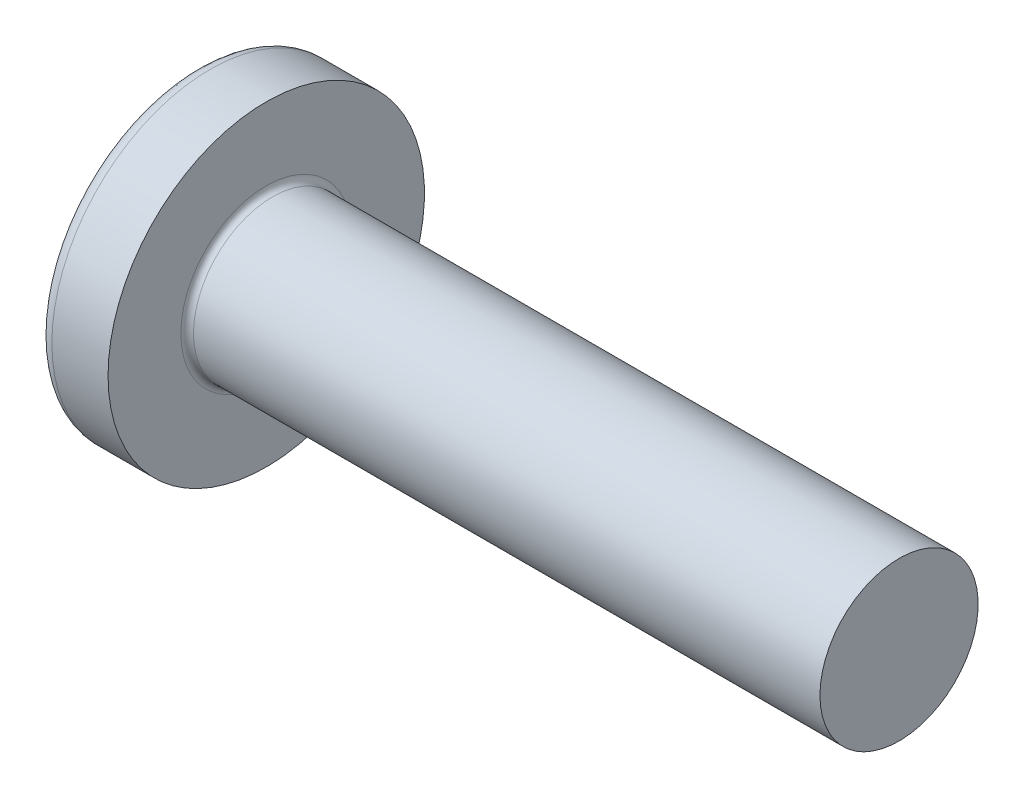
from build123d import *

# Parameters (mm, degrees)
RECPAT_COUNT = 2
RECPAT_ANGLE = 90


with BuildPart() as part:
    # Fillet1: read off the stored shape, not the designer's step
    # Fillet1 outline → Fillet1 (revolve)
    with BuildSketch(Plane.YX):
        with BuildLine():
            Line((5, 7.9), (5, 47.5))
            Line((5, 47.5), (0, 47.5))
            Line((0, 47.5), (0, 0))
            ThreePointArc((0, 0), (5.084799309, 0.829475422), (9.642384112, 3.231898002))
            ThreePointArc((9.642384112, 3.231898002), (9.905650574, 3.548946469), (10, 3.950103735))
            Line((10, 3.950103735), (10, 7.5))
            Line((10, 7.5), (5.4, 7.5))
            ThreePointArc((5.4, 7.5), (5.117157288, 7.617157288), (5, 7.9))
        make_face()
    revolve(axis=Axis((0, 0, 0), (1, 0, 0)))

    # Sketch3 → Recess section 0
    with BuildSketch(Plane(origin=(0, 0, 0), x_dir=(0, 0, -1), z_dir=(1, 0, 0))):
        with BuildLine():
            Line((1.08, -4.95), (-1.08, -4.95))
            Line((-1.08, -4.95), (-1.08, 4.95))
            Line((-1.08, 4.95), (1.08, 4.95))
            Line((1.08, 4.95), (1.08, -4.95))
        make_face()
    # Sketch4 → Recess section 1
    with BuildSketch(Plane(origin=(5.69, 0, 0), x_dir=(0, 0, -1), z_dir=(1, 0, 0))):
        with BuildLine():
            Line((1.08, -2.113071125), (-1.08, -2.113071125))
            Line((-1.08, -2.113071125), (-1.08, 2.113071125))
            Line((-1.08, 2.113071125), (1.08, 2.113071125))
            Line((1.08, 2.113071125), (1.08, -2.113071125))
        make_face()
    recess = loft(mode=Mode.SUBTRACT)

    # RecPat: Recess ×2 about axis
    recpat_axis = Axis((0, 0, 0), (1, 0, 0))
    for i in range(1, RECPAT_COUNT):
        add(recess.rotate(recpat_axis, i * RECPAT_ANGLE / (RECPAT_COUNT - 1)), mode=Mode.SUBTRACT)

    # RecCorSke → RecessCore (revolve, cut)
    with BuildSketch(Plane.XY, mode=Mode.PRIVATE) as recesscore_sk:
        Polygon((0, 0), (0, 2.32838356), (5.69, 1.9305), (6.317257474, 0), align=None)
    revolve(recesscore_sk.sketch.rotate(Axis((-3.175, 0, 0), (1, 0, 0)), 90), axis=Axis((-3.175, 0, 0), (1, 0, 0)), mode=Mode.SUBTRACT)


solid = part.part
